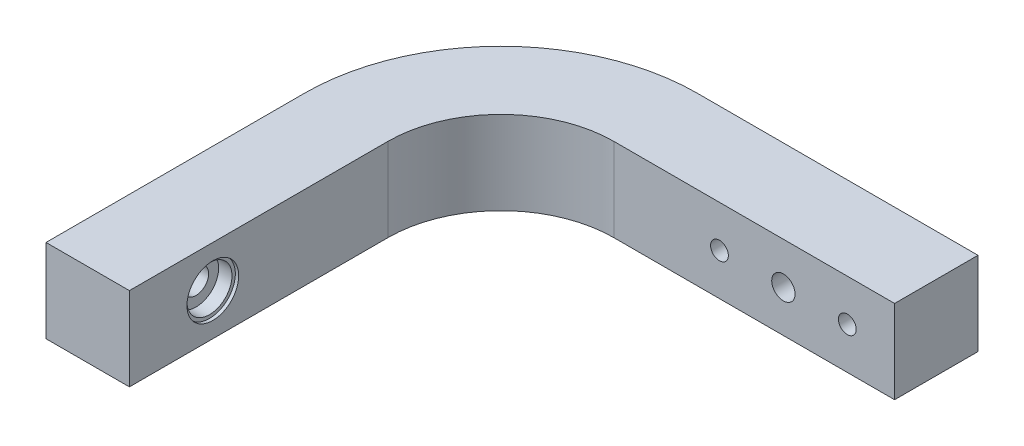
from build123d import *

# Parameters (mm, degrees)
BOSS_EXTRUDE1_DEPTH      = 7.5
BOSS_EXTRUDE1_DEPTH_BACK = 7.5
CUT_EXTRUDE1_DEPTH       = 109.450580006
CUT_EXTRUDE1_DEPTH_BACK  = 109.450580006
SKETCH2_R                = 2.25
SKETCH3_R                = 2.1
SKETCH3_R_2              = 1.6
CUT_EXTRUDE2_DEPTH       = 106.254370403


with BuildPart() as part:
    # Sketch1 → Boss-Extrude1 (new, two sides: drawn at the far end of the back side and taken through both)
    with BuildSketch(Plane(origin=(0, 0, 0), x_dir=(1, 0, 0), z_dir=(0, 1, 0)).offset(-BOSS_EXTRUDE1_DEPTH_BACK)):
        with BuildLine():
            Line((-65.80458146, -35.321832584), (-65.80458146, -81.80458146))
            Line((-65.80458146, -81.80458146), (-50.80458146, -81.80458146))
            Line((-50.80458146, -81.80458146), (-50.80458146, -35.321832584))
            ThreePointArc((-50.80458146, -35.321832584), (-44.852454502, -20.952126958), (-30.482748876, -15))
            Line((-30.482748876, -15), (20, -15))
            Line((20, -15), (20, 0))
            Line((20, 0), (-30.482748876, 0))
            ThreePointArc((-30.482748876, 0), (-55.45905622, -10.34552524), (-65.80458146, -35.321832584))
        make_face()
    extrude(amount=BOSS_EXTRUDE1_DEPTH + BOSS_EXTRUDE1_DEPTH_BACK)

    # Sketch2 → Cut-Extrude1 (cut, two sides: drawn at the far end of the back side and taken through both)
    with BuildSketch(Plane.ZY.offset(50.80458146).offset(-CUT_EXTRUDE1_DEPTH_BACK)):
        with Locations((66.80458146, 0)):
            Circle(SKETCH2_R)
    extrude(amount=CUT_EXTRUDE1_DEPTH + CUT_EXTRUDE1_DEPTH_BACK, mode=Mode.SUBTRACT)

    # Sketch3 → Cut-Extrude2 (cut, through all)
    with BuildSketch(Plane(origin=(0, 0, 0), x_dir=(-1, 0, 0), z_dir=(0, 0, -1))):
        Circle(SKETCH3_R)
        with Locations((-11.5, 0)):
            Circle(SKETCH3_R_2)
        with Locations((11.5, 0)):
            Circle(SKETCH3_R_2)
    extrude(amount=-CUT_EXTRUDE2_DEPTH, mode=Mode.SUBTRACT)

    # Sketch5 → bearing-seats (revolve, cut)
    with BuildSketch(Plane(origin=(0, 0, 0), x_dir=(1, 0, 0), z_dir=(0, 1, 0))):
        Polygon((-65.80458146, -71.45458146), (-65.20458146, -71.45458146), (-65.20458146, -70.85458146), (-62.80458146, -70.85458146), (-62.80458146, -66.80458146), (-65.80458146, -66.80458146), align=None)
        Polygon((-50.80458146, -66.80458146), (-53.80458146, -66.80458146), (-53.80458146, -70.85458146), (-51.40458146, -70.85458146), (-51.40458146, -71.45458146), (-50.80458146, -71.45458146), align=None)
    revolve(axis=Axis((-84.392341333, 0, 66.80458146), (1, 0, 0)), mode=Mode.SUBTRACT)


solid = part.part
